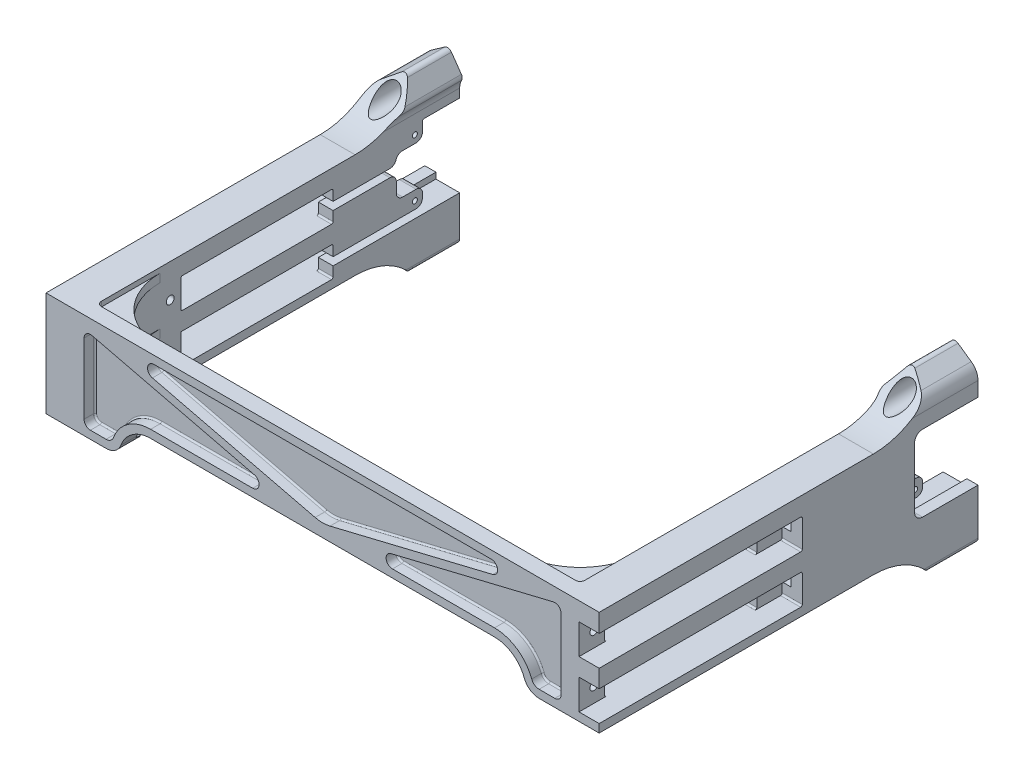
from build123d import *

# Parameters (mm, degrees)
BOSS_EXTRUDE1_DEPTH             = 10
SKETCH2_W                       = 109.5
SKETCH2_H                       = 33
BOSS_EXTRUDE2_DEPTH             = 11
SKETCH3_W                       = 5
SKETCH3_H                       = 33
BOSS_EXTRUDE3_DEPTH             = 76.25
FILLET1_R                       = 5
FILLET3_START                   = 10
FILLET3_OUTLINE_W               = 11
FILLET3_OUTLINE_H               = 8
FILLET3_DEPTH                   = 23
FILLET3_START_2                 = 75.125869623
FILLET3_2_DEPTH                 = 12.874130377
FILLET4_R                       = 1.5
CBORE_FOR_M3_SHCS1_D            = 3.2
CBORE_FOR_M3_SHCS1_CBORE_D      = 6.5
CBORE_FOR_M3_SHCS1_CBORE_DEPTH  = 112.5
SKETCH15_W                      = 20
SKETCH15_H                      = 24
CUT_EXTRUDE6_DEPTH              = 151.496054784
SKETCH16_W                      = 8.25
SKETCH16_H                      = 5.3868
SKETCH16_H_2                    = 0.5632
BOSS_EXTRUDE5_DEPTH             = 5.3
TAP_DRILL_FOR_M2X0_4_TAP1_D     = 1.6
TAP_DRILL_FOR_M2X0_4_TAP1_DEPTH = 11
TAP_DRILL_FOR_M2X0_4_TAP2_D     = 1.6
SKETCH8_W                       = 48
SKETCH8_H                       = 9.5
CUT_EXTRUDE1_DEPTH              = 205.374044434
SKETCH9_W                       = 48
SKETCH9_H                       = 9.5
CUT_EXTRUDE2_DEPTH              = 205.374044434
SKETCH11_W                      = 64
SKETCH11_H                      = 9.5
CUT_EXTRUDE3_DEPTH              = 6.35
SKETCH18_W                      = 64
SKETCH18_H                      = 9.5
CUT_EXTRUDE7_DEPTH              = 6.35
BOSS_EXTRUDE4_DEPTH             = 1.3
CUT_EXTRUDE4_START              = -63.4318
CUT_EXTRUDE4_OUTLINE_W          = 7.5
CUT_EXTRUDE4_OUTLINE_H          = 2.5
CUT_EXTRUDE4_DEPTH              = 63.4318
CUT_EXTRUDE5_REACH              = 152.496
SKETCH14_3_W                    = 7.5
SKETCH14_3_H                    = 2.5
FILLET5_R                       = 2.5
FILLET6_R                       = 1.5
FILLET7_R                       = 0.5
TAP_DRILL_FOR_M3X0_5_TAP2_D     = 2.5
TAP_DRILL_FOR_M3X0_5_TAP2_DEPTH = 8
TAP_DRILL_FOR_M3X0_5_TAP2_TIP   = 0.751075774
TAP_DRILL_FOR_M3X0_5_TAP3_D     = 2.5
FILLET8_R                       = 2
FILLET9_R                       = 2
FILLET10_R                      = 2
CUT_EXTRUDE8_DEPTH              = 151.496054921
FILLET11_R                      = 5
CUT_EXTRUDE9_START              = -6.35
CUT_EXTRUDE9_DEPTH              = 6.35
CUT_EXTRUDE10_DEPTH             = 3.5
FILLET12_R                      = 2
FILLET13_R                      = 0.5


with BuildPart() as part:
    # Sketch1 → Boss-Extrude1 (new body)
    with BuildSketch(Plane.XY):
        Polygon((75.125869723, 18.40506383), (76.25, 17.617939336), (76.25, -27.5), (87.25, -27.5), (87.25, 19.681853126), (79.714481214, 24.958280184), align=None)
    extrude(amount=BOSS_EXTRUDE1_DEPTH)

    # Sketch2 → Boss-Extrude2 (add)
    with BuildSketch(Plane.ZY.offset(-76.25)):
        with Locations((64.75, -3)):
            Rectangle(SKETCH2_W, SKETCH2_H)
    extrude(amount=-BOSS_EXTRUDE2_DEPTH)

    # Sketch3 → Boss-Extrude3 (add)
    with BuildSketch(Plane.ZY.offset(-76.25)):
        with Locations((117, -3)):
            Rectangle(SKETCH3_W, SKETCH3_H)
    extrude(amount=BOSS_EXTRUDE3_DEPTH)

    # Fillet1
    # the kernel refuses this fillet: 5 mm, written as the material it adds along each edge
    with BuildSketch(Plane(origin=(76.25, 17.617939336, 0), x_dir=(-0.8191520442890894, 0.5735764363509067, 0), z_dir=(0, 0, 1))) as fillet1_piece_1:
        with BuildLine():
            CenterArc((2.735457859, 4.810595289), FILLET1_R, 215, 39.179194345)
            Line((-1.360302362, 1.942713107), (0, 0))
            Line((0, 0), (1.372309676, 0))
        make_face()
    extrude(amount=10)
    # the kernel refuses this fillet: 5 mm, written as the material it takes off along each edge
    with BuildSketch(Plane(origin=(87.25, 19.681853126, -6.507088132), x_dir=(-0.8191520442889935, 0.5735764363510436, 0), z_dir=(0, 0, 1))) as fillet1_2_piece_1:
        with BuildLine():
            CenterArc((FILLET1_R * 0.520567050552, FILLET1_R), FILLET1_R, 215, 55)
            Line((-FILLET1_R * 0.298584993737, FILLET1_R * 0.426423563649), (0, 0))
            Line((0, 0), (FILLET1_R * 0.520567050552, 0))
        make_face()
    extrude(amount=23.014176264, mode=Mode.SUBTRACT)

    # Fillet3: read off the stored shape, not the designer's step
    # Fillet3 outline → Fillet3 (add)
    with BuildSketch(Plane.XY.offset(FILLET3_START)):
        with Locations((81.75, -23.5)):
            Rectangle(FILLET3_OUTLINE_W, FILLET3_OUTLINE_H)
        with BuildLine():
            Line((76.25, 15.246324542), (76.25, 13.5))
            Line((76.25, 13.5), (87.25, 13.5))
            Line((87.25, 13.5), (87.25, 17.079017873))
            ThreePointArc((87.25, 17.079017873), (86.685054166, 19.387760939), (85.117882182, 21.174778094))
            Line((85.117882182, 21.174778094), (79.714481214, 24.958280184))
            Line((79.714481214, 24.958280184), (75.125869723, 18.40506383))
            ThreePointArc((75.125869723, 18.40506383), (75.960591715, 16.922727146), (76.25, 15.246324542))
        make_face()
    extrude(amount=FILLET3_DEPTH)

    # Fillet3 2 outline → Fillet3 2 (cut)
    with BuildSketch(Plane.YZ.offset(FILLET3_START_2)):
        with BuildLine():
            ThreePointArc((-27.5, 15.564404226), (-21.59545504, 23.408336954), (-19.5, 33))
            Line((-19.5, 33), (-27.5, 33))
            Line((-27.5, 33), (-27.5, 15.564404226))
        make_face()
        with BuildLine():
            Line((24.958280184, 13.105560986), (26, 12.501209276))
            Line((26, 12.501209276), (26, 33))
            Line((26, 33), (13.5, 33))
            ThreePointArc((13.5, 33), (16.569375878, 21.520878861), (24.958280184, 13.105560986))
        make_face()
    extrude(amount=FILLET3_2_DEPTH, mode=Mode.SUBTRACT)

    # Fillet4
    fillet4_edges = [part.edges().sort_by_distance(p)[0] for p in [
        (76.25, -27.5, 7.782202113),
        (87.25, -27.5, 7.782202113),
        (79.714481214, 24.958280184, 5),
        (75.125869723, 18.40506383, 5),
    ]]
    fillet(fillet4_edges, radius=FILLET4_R)

    # CBORE for M3 SHCS1 (through all)
    with Locations(Plane.XY.offset(119.5)):
        with Locations((81.25, 19), (81.75, -23)):
            CounterBoreHole(CBORE_FOR_M3_SHCS1_D / 2, CBORE_FOR_M3_SHCS1_CBORE_D / 2, CBORE_FOR_M3_SHCS1_CBORE_DEPTH)

    # Sketch15 → Cut-Extrude6 (cut, through all)
    with BuildSketch(Plane.ZY.offset(-87.25)):
        with Locations((10, 0.5)):
            Rectangle(SKETCH15_W, SKETCH15_H)
    extrude(amount=CUT_EXTRUDE6_DEPTH, mode=Mode.SUBTRACT)

    # Sketch16 → Boss-Extrude5 (add)
    with BuildSketch(Plane.ZY.offset(-76.25)):
        with Locations((15.875, -8.2434)):
            Rectangle(SKETCH16_W, SKETCH16_H)
        with Locations((15.875, -11.2184)):
            Rectangle(SKETCH16_W, SKETCH16_H_2)
        with Locations((15.875, 9.8066)):
            Rectangle(SKETCH16_W, SKETCH16_H)
    extrude(amount=-BOSS_EXTRUDE5_DEPTH)

    # Mirror1: part across plane


with BuildPart() as part_1:
    add(part.part)
    add(part.part.mirror(Plane(origin=(0, 0, 0), x_dir=(0, 0, 1), z_dir=(1, 0, 0))))

    # Tap Drill for M2x0.4 Tap1
    with Locations(Plane.ZY.offset(-76.25)):
        with Locations((14.15, 9.525), (14.15, -8.525)):
            Hole(TAP_DRILL_FOR_M2X0_4_TAP1_D / 2, depth=TAP_DRILL_FOR_M2X0_4_TAP1_DEPTH)

    # Tap Drill for M2x0.4 Tap2 (through all)
    with Locations(Plane.ZY.offset(81.55)):
        with Locations((14.15, 9.525), (14.15, -8.525)):
            Hole(TAP_DRILL_FOR_M2X0_4_TAP2_D / 2)

    # Sketch8 → Cut-Extrude1 (cut, through all)
    with BuildSketch(Plane.ZY.offset(-76.25)):
        with Locations((87.4318, 2.9691)):
            Rectangle(SKETCH8_W, SKETCH8_H)
        with Locations((87.4318, -12.1439)):
            Rectangle(SKETCH8_W, SKETCH8_H)
    extrude(amount=-CUT_EXTRUDE1_DEPTH, mode=Mode.SUBTRACT)

    # Sketch9 → Cut-Extrude2 (cut, through all)
    with BuildSketch(Plane(origin=(-76.25, 0, 0), x_dir=(0, 0, -1), z_dir=(1, 0, 0))):
        with Locations((-63.9368, 2.9691)):
            Rectangle(SKETCH9_W, SKETCH9_H)
        with Locations((-63.9368, -12.1439)):
            Rectangle(SKETCH9_W, SKETCH9_H)
    extrude(amount=-CUT_EXTRUDE2_DEPTH, mode=Mode.SUBTRACT)

    # Sketch11 → Cut-Extrude3 (cut)
    with BuildSketch(Plane(origin=(87.25, 0, 0), x_dir=(0, 0, -1), z_dir=(1, 0, 0))):
        with Locations((-87.4318, 2.9691)):
            Rectangle(SKETCH11_W, SKETCH11_H)
        with Locations((-87.4318, -12.1439)):
            Rectangle(SKETCH11_W, SKETCH11_H)
    extrude(amount=-CUT_EXTRUDE3_DEPTH, mode=Mode.SUBTRACT)

    # Sketch18 → Cut-Extrude7 (cut)
    with BuildSketch(Plane.ZY.offset(87.25)):
        with Locations((63.9368, 2.9691)):
            Rectangle(SKETCH18_W, SKETCH18_H)
        with Locations((63.9368, -12.1439)):
            Rectangle(SKETCH18_W, SKETCH18_H)
    extrude(amount=-CUT_EXTRUDE7_DEPTH, mode=Mode.SUBTRACT)

    # Sketch13 → Boss-Extrude4 (add, symmetric)
    with BuildSketch(Plane(origin=(0, -18.19695, 0), x_dir=(1, 0, 0), z_dir=(0, 1, 0))):
        with BuildLine():
            Line((76.25, -114.5), (76.25, -94.5))
            ThreePointArc((76.25, -94.5), (70.392135624, -108.642135624), (56.25, -114.5))
            Line((56.25, -114.5), (76.25, -114.5))
        make_face()
        with BuildLine():
            Line((-76.25, -114.5), (-76.25, -94.5))
            ThreePointArc((-76.25, -94.5), (-70.392135624, -108.642135624), (-56.25, -114.5))
            Line((-56.25, -114.5), (-76.25, -114.5))
        make_face()
    boss_extrude4 = extrude(amount=BOSS_EXTRUDE4_DEPTH, both=True)

    # Sketch-Pattern8: Boss-Extrude4 at 2 more places
    with Locations((0, 28.8065, 0), (0, 13.60955, 0)):
        add(boss_extrude4)

    # Cut-Extrude4: read off the stored shape, not the designer's step
    # Cut-Extrude4 outline → Cut-Extrude4 (cut)
    with BuildSketch(Plane(origin=(0, 0, 0), x_dir=(-1, 0, 0), z_dir=(0, 0, -1)).offset(CUT_EXTRUDE4_START)):
        with Locations((-80, 2.9691)):
            Rectangle(CUT_EXTRUDE4_OUTLINE_W, CUT_EXTRUDE4_OUTLINE_H)
        with Locations((-80, -12.1439)):
            Rectangle(CUT_EXTRUDE4_OUTLINE_W, CUT_EXTRUDE4_OUTLINE_H)
    extrude(amount=CUT_EXTRUDE4_DEPTH, mode=Mode.SUBTRACT)

    # Cut-Extrude5: up to this face of the body (flat: up to its plane)
    cut_extrude5_end = Plane(part_1.part.faces().sort_by_distance((-78.575, 2.9691, 87.9368))[0])
    # Sketch14<3> → Cut-Extrude5 (cut, up to the picked face)
    with BuildSketch(Plane(origin=(0, 0, 0), x_dir=(-1, 0, 0), z_dir=(0, 0, -1)), mode=Mode.PRIVATE) as cut_extrude5_sk1:
        with Locations((80, 2.9691)):
            Rectangle(SKETCH14_3_W, SKETCH14_3_H)
    cut_extrude5_tool1 = split(extrude(cut_extrude5_sk1.sketch, amount=-CUT_EXTRUDE5_REACH, mode=Mode.PRIVATE), bisect_by=cut_extrude5_end, keep=Keep.BOTH, mode=Mode.PRIVATE)
    # Sketch14<3> → Cut-Extrude5 (cut, up to the picked face)
    with BuildSketch(Plane(origin=(0, 0, 0), x_dir=(-1, 0, 0), z_dir=(0, 0, -1)), mode=Mode.PRIVATE) as cut_extrude5_sk2:
        with Locations((80, -12.1439)):
            Rectangle(SKETCH14_3_W, SKETCH14_3_H)
    cut_extrude5_tool2 = split(extrude(cut_extrude5_sk2.sketch, amount=-CUT_EXTRUDE5_REACH, mode=Mode.PRIVATE), bisect_by=cut_extrude5_end, keep=Keep.BOTH, mode=Mode.PRIVATE)
    add(cut_extrude5_tool1.solids().sort_by(Axis((-80, 2.9691, 0), (0, 0, 1)))[0], mode=Mode.SUBTRACT)
    add(cut_extrude5_tool2.solids().sort_by(Axis((-80, -12.1439, 0), (0, 0, 1)))[0], mode=Mode.SUBTRACT)

    # Fillet5
    fillet5_edges = [part_1.edges().sort_by_distance(p)[0] for p in [
        (84.4, 12.5, 20),
        (85.5, -11.5, 20),
        (-84.4, 12.5, 20),
        (-85.5, -11.5, 20),
    ]]
    fillet(fillet5_edges, radius=FILLET5_R)

    # Fillet6
    fillet6_edges = [part_1.edges().sort_by_distance(p)[0] for p in [
        (-76.25, 12.704775, 114.5),
        (76.25, 12.704775, 114.5),
        (76.25, 3.011075, 114.5),
        (-76.25, 3.011075, 114.5),
        (76.25, -11.392175, 114.5),
        (-76.25, -11.392175, 114.5),
    ]]
    fillet(fillet6_edges, radius=FILLET6_R)

    # Fillet7
    fillet7_edges = [part_1.edges().sort_by_distance(p)[0] for p in [
        (78.9, 12.5, 11.75),
        (-78.9, 12.5, 11.75),
        (78.575, -1.7809, 111.4318),
        (78.575, -1.7809, 63.4318),
        (78.575, 7.7191, 111.4318),
        (78.575, 7.7191, 63.4318),
        (84.075, -1.7809, 55.4318),
        (84.075, 7.7191, 119.4318),
        (84.075, 7.7191, 55.4318),
        (84.075, -1.7809, 119.4318),
        (78.575, -16.8939, 111.4318),
        (78.575, -16.8939, 63.4318),
        (78.575, -7.3939, 111.4318),
        (78.575, -7.3939, 63.4318),
        (84.075, -7.3939, 119.4318),
        (84.075, -16.8939, 55.4318),
        (84.075, -16.8939, 119.4318),
        (84.075, -7.3939, 55.4318),
        (-78.575, -1.7809, 39.9368),
        (-78.575, -1.7809, 87.9368),
        (-78.575, 7.7191, 39.9368),
        (-78.575, 7.7191, 87.9368),
        (-84.075, 7.7191, 31.9368),
        (-84.075, -1.7809, 95.9368),
        (-84.075, 7.7191, 95.9368),
        (-78.575, -16.8939, 39.9368),
        (-78.575, -7.3939, 39.9368),
        (-84.075, -16.8939, 95.9368),
        (-84.075, -16.8939, 31.9368),
        (-84.075, -7.3939, 95.9368),
    ]]
    fillet(fillet7_edges, radius=FILLET7_R)

    # Tap Drill for M3x0.5 Tap2
    with Locations(Plane(origin=(80.9, 0, 0), x_dir=(0, 0, -1), z_dir=(1, 0, 0))):
        with Locations((-114.813, 2.9691), (-114.813, -12.1439)):
            Hole(TAP_DRILL_FOR_M3X0_5_TAP2_D / 2, depth=TAP_DRILL_FOR_M3X0_5_TAP2_DEPTH)
            with Locations((0, 0, -(TAP_DRILL_FOR_M3X0_5_TAP2_DEPTH + TAP_DRILL_FOR_M3X0_5_TAP2_TIP / 2))):  # 118° drill point
                Cone(0, TAP_DRILL_FOR_M3X0_5_TAP2_D / 2, TAP_DRILL_FOR_M3X0_5_TAP2_TIP, mode=Mode.SUBTRACT)

    # Tap Drill for M3x0.5 Tap3 (through all)
    with Locations(Plane.ZY.offset(80.9)):
        with Locations((91.318, 2.9691), (91.318, -12.1439)):
            Hole(TAP_DRILL_FOR_M3X0_5_TAP3_D / 2)

    # Fillet8
    fillet8_edges = [part_1.edges().sort_by_distance(p)[0] for p in [
        (78.9, -5.55, 11.75),
        (78.9, 7.1132, 11.75),
        (-78.9, -5.55, 11.75),
        (-78.9, 7.1132, 11.75),
    ]]
    fillet(fillet8_edges, radius=FILLET8_R)

    # Fillet9
    fillet9_edges = [part_1.edges().sort_by_distance(p)[0] for p in [
        (80, 1.7191, 20),
        (80, 4.2191, 20),
        (78.9, -10.8939, 11.75),
        (-80, 1.7191, 20),
        (-80, 4.2191, 20),
        (-78.9, -10.8939, 11.75),
    ]]
    fillet(fillet9_edges, radius=FILLET9_R)

    # Fillet10
    # the kernel refuses this fillet: 2 mm, written as the material it adds along each edge
    with BuildSketch(Plane(origin=(76.25, -5.55, 20), x_dir=(0, 1, 0), z_dir=(1, 0, 0)), Plane(origin=(-76.25, -5.55, 20), x_dir=(0, 0, -1), z_dir=(-1, 0, 0))) as fillet10_piece_1:
        with BuildLine():
            CenterArc((FILLET10_R, -FILLET10_R), FILLET10_R, 90, 90)
            Line((0, -FILLET10_R), (0, 0))
            Line((0, 0), (FILLET10_R, 0))
        make_face()
    extrude(amount=5.3)
    with BuildSketch(Plane(origin=(76.25, 7.1132, 20), x_dir=(0, 0, -1), z_dir=(1, 0, 0))) as fillet10_piece_2:
        with BuildLine():
            CenterArc((1.844084441, -2), FILLET10_R, 90, 73.950066168)
            Line((-0.077957779, -1.44705), (-0.270162002, -1.391755))
            ThreePointArc((-0.270162002, -1.391755), (-0.2, -0.8941), (-0.2, 0))
            Line((-0.2, 0), (0, 0.2))
            Line((0, 0.2), (1.844084441, 0.2))
            Line((1.844084441, 0.2), (1.844084441, 0))
        make_face()
    extrude(amount=5.3)
    with BuildSketch(Plane(origin=(-76.25, 7.1132, 20), x_dir=(0, 0, -1), z_dir=(-1, 0, 0))) as fillet10_piece_3:
        with BuildLine():
            CenterArc((1.844084441, 2), FILLET10_R, 196.049933832, 73.950066168)
            Line((-0.077957779, 1.44705), (-0.270162002, 1.391755))
            ThreePointArc((-0.270162002, 1.391755), (-0.2, 0.8941), (-0.2, 0))
            Line((-0.2, 0), (0, -0.2))
            Line((0, -0.2), (1.844084441, -0.2))
            Line((1.844084441, -0.2), (1.844084441, 0))
        make_face()
    extrude(amount=5.3)

    # Sketch28 → Cut-Extrude8 (cut, through all)
    with BuildSketch(Plane.XY.offset(119.5)):
        with BuildLine():
            Line((54.25, -9.75), (-54.25, -9.75))
            ThreePointArc((-54.25, -9.75), (-61.232120022, -12.591089468), (-64.246874512, -19.5))
            Line((-64.246874512, -19.5), (-44.253125488, -19.5))
            Line((-44.253125488, -19.5), (44.253125488, -19.5))
            Line((44.253125488, -19.5), (64.246874512, -19.5))
            ThreePointArc((64.246874512, -19.5), (61.232120022, -12.591089468), (54.25, -9.75))
        make_face()
    extrude(amount=-CUT_EXTRUDE8_DEPTH, mode=Mode.SUBTRACT)

    # Fillet11
    fillet11_edges = [part_1.edges().sort_by_distance(p)[0] for p in [
        (64.246874512, -19.5, 117),
        (-64.246874512, -19.5, 117),
    ]]
    fillet(fillet11_edges, radius=FILLET11_R)

    # Sketch29 → Cut-Extrude9 (cut)
    with BuildSketch(Plane(origin=(87.25, 0, 0), x_dir=(0, 0, -1), z_dir=(1, 0, 0)).offset(CUT_EXTRUDE9_START)):
        with BuildLine():
            ThreePointArc((-119.4318, 7.2191), (-119.285353391, 7.572653391), (-118.9318, 7.7191))
            Line((-118.9318, 7.7191), (-119.5, 7.7191))
            Line((-119.5, 7.7191), (-119.5, -1.7809))
            Line((-119.5, -1.7809), (-118.9318, -1.7809))
            ThreePointArc((-118.9318, -1.7809), (-119.285353391, -1.634453391), (-119.4318, -1.2809))
            Line((-119.4318, -1.2809), (-119.4318, 7.2191))
        make_face()
        with BuildLine():
            Line((-118.9318, -7.3939), (-119.5, -7.3939))
            Line((-119.5, -7.3939), (-119.5, -16.8939))
            Line((-119.5, -16.8939), (-118.9318, -16.8939))
            ThreePointArc((-118.9318, -16.8939), (-119.285353391, -16.747453391), (-119.4318, -16.3939))
            Line((-119.4318, -16.3939), (-119.4318, -7.8939))
            ThreePointArc((-119.4318, -7.8939), (-119.285353391, -7.540346609), (-118.9318, -7.3939))
        make_face()
    extrude(amount=CUT_EXTRUDE9_DEPTH, mode=Mode.SUBTRACT)

    # Sketch30 → Cut-Extrude10 (cut)
    with BuildSketch(Plane.XY.offset(119.5)):
        with BuildLine():
            Line((69.946477995, 11), (-69.946477995, 11))
            Line((-69.946477995, 11), (-2.356924321, -5.392150891))
            ThreePointArc((-2.356924321, -5.392150891), (0, -5.673873896), (2.356924321, -5.392150891))
            Line((2.356924321, -5.392150891), (69.946477995, 11))
        make_face()
        with BuildLine():
            Line((-75.25, 9.713763766), (-75.25, -17))
            Line((-75.25, -17), (-68.301245496, -17))
            ThreePointArc((-68.301245496, -17), (-66.876026215, -16.553959591), (-65.959371247, -15.375))
            ThreePointArc((-65.959371247, -15.375), (-61.376096407, -9.480202047), (-54.25, -7.25))
            Line((-54.25, -7.25), (-5.303522005, -7.25))
            Line((-5.303522005, -7.25), (-75.25, 9.713763766))
        make_face()
        with BuildLine():
            Line((75.25, 9.713763766), (5.303522005, -7.25))
            Line((5.303522005, -7.25), (54.25, -7.25))
            ThreePointArc((54.25, -7.25), (61.376096407, -9.480202047), (65.959371247, -15.375))
            ThreePointArc((65.959371247, -15.375), (66.876026215, -16.553959591), (68.301245496, -17))
            Line((68.301245496, -17), (75.25, -17))
            Line((75.25, -17), (75.25, 9.713763766))
        make_face()
    extrude(amount=-CUT_EXTRUDE10_DEPTH, mode=Mode.SUBTRACT)

    # Fillet12
    fillet12_edges = [part_1.edges().sort_by_distance(p)[0] for p in [
        (-69.946477995, 11, 117.75),
        (69.946477995, 11, 117.75),
        (-75.25, -17, 117.75),
        (-75.25, 9.713763766, 117.75),
        (-5.303522005, -7.25, 117.75),
        (75.25, 9.713763766, 117.75),
        (5.303522005, -7.25, 117.75),
        (75.25, -17, 117.75),
    ]]
    fillet(fillet12_edges, radius=FILLET12_R)

    # Fillet13
    # the kernel refuses this fillet: 0.5 mm, written as the material it adds along each edge
    with BuildSketch(Plane(origin=(-53.685652309, 7.056344601, 116), x_dir=(0, 0, 1), z_dir=(0.9718276994675079, -0.23569243209677143, 0)), Plane(origin=(2.356924321, -5.392150891, 116), x_dir=(0, 0, 1), z_dir=(0.9718276994675079, 0.23569243209677143, 0))) as fillet13_piece_1:
        with BuildLine():
            CenterArc((FILLET13_R, -FILLET13_R), FILLET13_R, 90, 90)
            Line((0, -FILLET13_R), (0, 0))
            Line((0, 0), (FILLET13_R, 0))
        make_face()
    extrude(amount=52.816695816)
    with BuildSketch(Plane(origin=(0, 4.326126104, 116), x_dir=(-0.23569243209677077, -0.971827699467508, 0), z_dir=(-0.971827699467508, 0.23569243209677077, 0))) as fillet13_piece_2:
        with BuildLine():
            CenterArc((10 - FILLET13_R, FILLET13_R), FILLET13_R, 270, 90)
            Line((10 - FILLET13_R, 0), (10, 0))
            Line((10, 0), (10, FILLET13_R))
        make_face()
    revolve(axis=Axis((0, 4.326126104, 116), (0, 0, 1)), revolution_arc=27.264885561)
    with BuildSketch(Plane(origin=(-54.25, -7.25, 116), x_dir=(0, 0, 1), z_dir=(1, 0, 0)), Plane(origin=(22.035732555, -7.25, 116), x_dir=(0, 0, 1), z_dir=(1, 0, 0))) as fillet13_piece_3:
        with BuildLine():
            CenterArc((FILLET13_R, -FILLET13_R), FILLET13_R, 90, 90)
            Line((0, -FILLET13_R), (0, 0))
            Line((0, 0), (FILLET13_R, 0))
        make_face()
    extrude(amount=32.214267445)
    with BuildSketch(Plane(origin=(-54.25, -19.75, 116), x_dir=(-0.9367496997597619, 0.3499999999999942, 0), z_dir=(-0.3499999999999942, -0.9367496997597619, 0))) as fillet13_piece_4:
        with BuildLine():
            CenterArc((12.5 + FILLET13_R, -FILLET13_R), FILLET13_R, 90, 90)
            Line((12.5 + FILLET13_R, 0), (12.5, 0))
            Line((12.5, 0), (12.5, -FILLET13_R))
        make_face()
    revolve(axis=Axis((-54.25, -19.75, 116), (0, 0, -1)), revolution_arc=69.512684885)
    with BuildSketch(Plane(origin=(-68.301245496, -14.5, 116), x_dir=(0, -1, 0), z_dir=(-1, 0, 0))) as fillet13_piece_5:
        with BuildLine():
            CenterArc((2.5 - FILLET13_R, FILLET13_R), FILLET13_R, 270, 90)
            Line((2.5 - FILLET13_R, 0), (2.5, 0))
            Line((2.5, 0), (2.5, FILLET13_R))
        make_face()
    revolve(axis=Axis((-68.301245496, -14.5, 116), (0, 0, 1)), revolution_arc=69.512684885)
    with BuildSketch(Plane(origin=(75.25, -13.00206968, 116), x_dir=(0, 0, 1), z_dir=(0, 1, 0))) as fillet13_piece_6_section:
        with BuildLine():
            CenterArc((FILLET13_R, -FILLET13_R), FILLET13_R, 90, 90)
            Line((0, -FILLET13_R), (0, 0))
            Line((0, 0), (FILLET13_R, 0))
        make_face()
    fillet13_piece_6 = extrude(amount=16.829339359, mode=Mode.PRIVATE)
    fillet13_piece_6 = fillet13_piece_6 - Plane(origin=(75.25, -12.1439, 114.813), x_dir=(0, 0, 1), z_dir=(-1, 0, 0)) * Cylinder(1.25, 36, mode=Mode.PRIVATE)
    fillet13_piece_6 = fillet13_piece_6 - Plane(origin=(75.25, 2.9691, 114.813), x_dir=(0, 0, 1), z_dir=(-1, 0, 0)) * Cylinder(1.25, 36, mode=Mode.PRIVATE)
    add(fillet13_piece_6)
    with BuildSketch(Plane(origin=(75.25, 2.11093032, 116), x_dir=(0, 0, 1), z_dir=(0, 1, 0))) as fillet13_piece_7_section:
        with BuildLine():
            CenterArc((FILLET13_R, -FILLET13_R), FILLET13_R, 90, 90)
            Line((0, -FILLET13_R), (0, 0))
            Line((0, 0), (FILLET13_R, 0))
        make_face()
    fillet13_piece_7 = extrude(amount=5.059805638, mode=Mode.PRIVATE)
    fillet13_piece_7 = fillet13_piece_7 - Plane(origin=(75.25, 2.9691, 114.813), x_dir=(0, 0, 1), z_dir=(-1, 0, 0)) * Cylinder(1.25, 13, mode=Mode.PRIVATE)
    add(fillet13_piece_7)
    with BuildSketch(Plane(origin=(68.301245496, -14.5, 116), x_dir=(-0.9367496997597655, -0.34999999999998416, 0), z_dir=(-0.34999999999998416, 0.9367496997597655, 0))) as fillet13_piece_8:
        with BuildLine():
            CenterArc((2.5 - FILLET13_R, FILLET13_R), FILLET13_R, 270, 90)
            Line((2.5 - FILLET13_R, 0), (2.5, 0))
            Line((2.5, 0), (2.5, FILLET13_R))
        make_face()
    revolve(axis=Axis((68.301245496, -14.5, 116), (0, 0, 1)), revolution_arc=69.512684885)
    with BuildSketch(Plane(origin=(54.25, -19.75, 116), x_dir=(0, 1, 0), z_dir=(-1, 0, 0))) as fillet13_piece_9:
        with BuildLine():
            CenterArc((12.5 + FILLET13_R, -FILLET13_R), FILLET13_R, 90, 90)
            Line((12.5 + FILLET13_R, 0), (12.5, 0))
            Line((12.5, 0), (12.5, -FILLET13_R))
        make_face()
    revolve(axis=Axis((54.25, -19.75, 116), (0, 0, -1)), revolution_arc=69.512684885)
    with BuildSketch(Plane(origin=(68.301245496, -17, 116), x_dir=(0, 0, 1), z_dir=(1, 0, 0)), Plane(origin=(-73.25, -17, 116), x_dir=(0, 0, 1), z_dir=(1, 0, 0))) as fillet13_piece_10:
        with BuildLine():
            CenterArc((FILLET13_R, -FILLET13_R), FILLET13_R, 90, 90)
            Line((0, -FILLET13_R), (0, 0))
            Line((0, 0), (FILLET13_R, 0))
        make_face()
    extrude(amount=4.948754504)
    with BuildSketch(Plane(origin=(53.214267445, 11, 116), x_dir=(0, 0, 1), z_dir=(-1, 0, 0))) as fillet13_piece_11:
        with BuildLine():
            CenterArc((FILLET13_R, -FILLET13_R), FILLET13_R, 90, 90)
            Line((0, -FILLET13_R), (0, 0))
            Line((0, 0), (FILLET13_R, 0))
        make_face()
    extrude(amount=106.42853489)
    with BuildSketch(Plane(origin=(-53.214267445, 9, 116), x_dir=(-0.2356924320967727, -0.9718276994675077, 0), z_dir=(0.9718276994675077, -0.2356924320967727, 0))) as fillet13_piece_12:
        with BuildLine():
            CenterArc((2 - FILLET13_R, -FILLET13_R), FILLET13_R, 0, 90)
            Line((2 - FILLET13_R, 0), (2, 0))
            Line((2, 0), (2, -FILLET13_R))
        make_face()
    revolve(axis=Axis((-53.214267445, 9, 116), (0, 0, -1)), revolution_arc=166.36755722)
    with BuildSketch(Plane(origin=(53.214267445, 9, 116), x_dir=(0, 1, 0), z_dir=(-1, 0, 0))) as fillet13_piece_13:
        with BuildLine():
            CenterArc((2 - FILLET13_R, -FILLET13_R), FILLET13_R, 0, 90)
            Line((2 - FILLET13_R, 0), (2, 0))
            Line((2, 0), (2, -FILLET13_R))
        make_face()
    revolve(axis=Axis((53.214267445, 9, 116), (0, 0, -1)), revolution_arc=166.36755722)
    with BuildSketch(Plane(origin=(75.25, -15, 116), x_dir=(0, 0, 1), z_dir=(0, 1, 0))) as fillet13_piece_14_section:
        with BuildLine():
            CenterArc((FILLET13_R, -FILLET13_R), FILLET13_R, 90, 90)
            Line((0, -FILLET13_R), (0, 0))
            Line((0, 0), (FILLET13_R, 0))
        make_face()
    fillet13_piece_14 = extrude(amount=3.71426968, mode=Mode.PRIVATE)
    fillet13_piece_14 = fillet13_piece_14 - Plane(origin=(75.25, -12.1439, 114.813), x_dir=(0, 0, 1), z_dir=(-1, 0, 0)) * Cylinder(1.25, 10, mode=Mode.PRIVATE)
    add(fillet13_piece_14)
    with BuildSketch(Plane(origin=(72.778615136, 9.114391357, 116), x_dir=(0, 0, 1), z_dir=(-0.9718276994675079, -0.23569243209677143, 0)), Plane(origin=(-21.564347691, -3.306344601, 116), x_dir=(0, 0, 1), z_dir=(-0.9718276994675079, 0.23569243209677143, 0))) as fillet13_piece_15:
        with BuildLine():
            CenterArc((FILLET13_R, -FILLET13_R), FILLET13_R, 90, 90)
            Line((0, -FILLET13_R), (0, 0))
            Line((0, 0), (FILLET13_R, 0))
        make_face()
    extrude(amount=52.698917177)
    with BuildSketch(Plane(origin=(22.035732555, -5.25, 116), x_dir=(0, -1, 0), z_dir=(1, 0, 0))) as fillet13_piece_16:
        with BuildLine():
            CenterArc((2 - FILLET13_R, -FILLET13_R), FILLET13_R, 0, 90)
            Line((2 - FILLET13_R, 0), (2, 0))
            Line((2, 0), (2, -FILLET13_R))
        make_face()
    revolve(axis=Axis((22.035732555, -5.25, 116), (0, 0, -1)), revolution_arc=166.36755722)
    with BuildSketch(Plane(origin=(73.25, 7.170735958, 116), x_dir=(1, 0, 0), z_dir=(0, -1, 0))) as fillet13_piece_17:
        with BuildLine():
            CenterArc((2 - FILLET13_R, FILLET13_R), FILLET13_R, 270, 90)
            Line((2 - FILLET13_R, 0), (2, 0))
            Line((2, 0), (2, FILLET13_R))
        make_face()
    revolve(axis=Axis((73.25, 7.170735958, 116), (0, 0, 1)), revolution_arc=103.63244278)
    with BuildSketch(Plane(origin=(73.25, -15, 116), x_dir=(1, 0, 0), z_dir=(0, 1, 0))) as fillet13_piece_18:
        with BuildLine():
            CenterArc((2 - FILLET13_R, -FILLET13_R), FILLET13_R, 0, 90)
            Line((2 - FILLET13_R, 0), (2, 0))
            Line((2, 0), (2, -FILLET13_R))
        make_face()
    revolve(axis=Axis((73.25, -15, 116), (0, 0, -1)), revolution_arc=90)
    with BuildSketch(Plane(origin=(-75.25, 7.170735958, 116), x_dir=(0, 0, 1), z_dir=(0, -1, 0))) as fillet13_piece_19:
        with BuildLine():
            CenterArc((FILLET13_R, -FILLET13_R), FILLET13_R, 90, 90)
            Line((0, -FILLET13_R), (0, 0))
            Line((0, 0), (FILLET13_R, 0))
        make_face()
    extrude(amount=22.170735958)
    with BuildSketch(Plane(origin=(-73.25, 7.170735958, 116), x_dir=(-1, 0, 0), z_dir=(0, -1, 0))) as fillet13_piece_20:
        with BuildLine():
            CenterArc((2 - FILLET13_R, -FILLET13_R), FILLET13_R, 0, 90)
            Line((2 - FILLET13_R, 0), (2, 0))
            Line((2, 0), (2, -FILLET13_R))
        make_face()
    revolve(axis=Axis((-73.25, 7.170735958, 116), (0, 0, -1)), revolution_arc=103.63244278)
    with BuildSketch(Plane(origin=(-73.25, -15, 116), x_dir=(0, -1, 0), z_dir=(1, 0, 0))) as fillet13_piece_21:
        with BuildLine():
            CenterArc((2 - FILLET13_R, -FILLET13_R), FILLET13_R, 0, 90)
            Line((2 - FILLET13_R, 0), (2, 0))
            Line((2, 0), (2, -FILLET13_R))
        make_face()
    revolve(axis=Axis((-73.25, -15, 116), (0, 0, -1)), revolution_arc=90)
    with BuildSketch(Plane(origin=(-22.035732555, -5.25, 116), x_dir=(0, -1, 0), z_dir=(-1, 0, 0))) as fillet13_piece_22:
        with BuildLine():
            CenterArc((2 - FILLET13_R, FILLET13_R), FILLET13_R, 270, 90)
            Line((2 - FILLET13_R, 0), (2, 0))
            Line((2, 0), (2, FILLET13_R))
        make_face()
    revolve(axis=Axis((-22.035732555, -5.25, 116), (0, 0, 1)), revolution_arc=166.36755722)


solid = part_1.part
